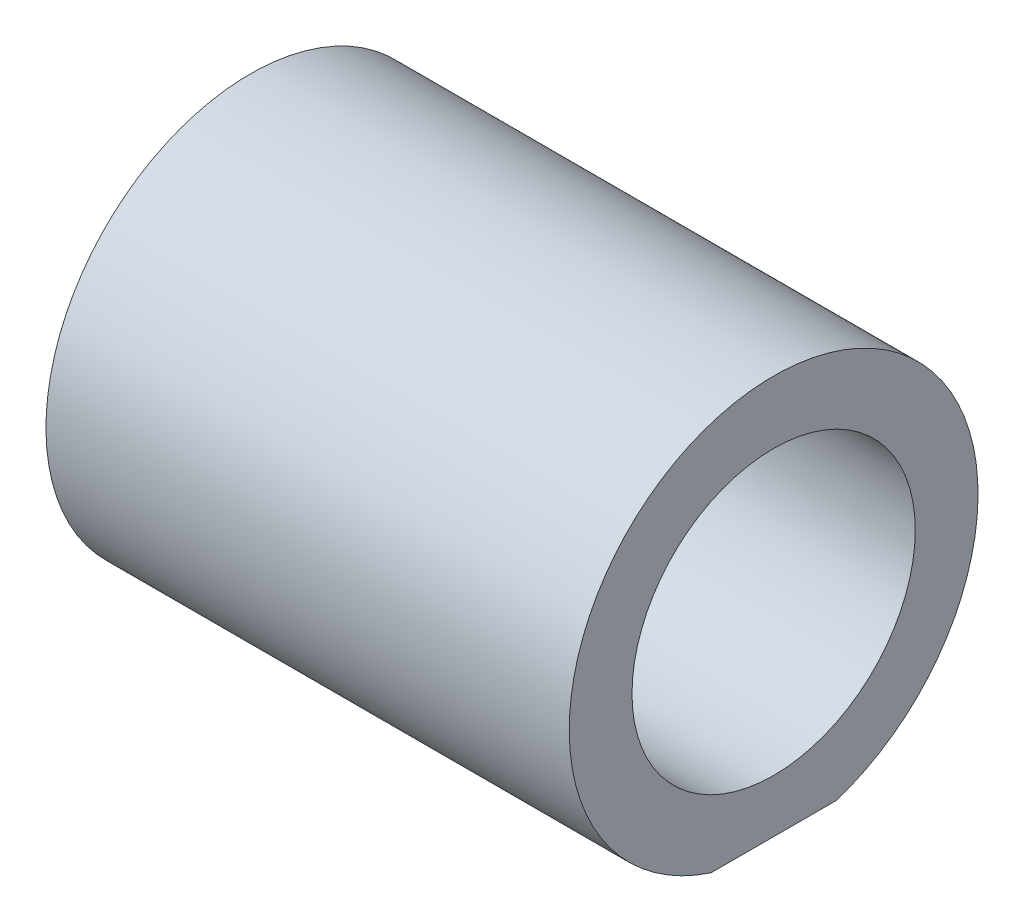
from build123d import *

# Parameters (mm, degrees)
SKETCH1_R           = 5.500000049
BOSS_EXTRUDE1_DEPTH = 20.32


with BuildPart() as part:
    # Sketch1 → Boss-Extrude1 (new body)
    with BuildSketch(Plane.YZ):
        with BuildLine():
            Line((-7.5565, -2.429653062), (-7.5565, 2.429653062))
            ThreePointArc((-7.5565, 2.429653062), (7.9375, 0), (-7.5565, -2.429653062))
        make_face()
        Circle(SKETCH1_R, mode=Mode.SUBTRACT)
    extrude(amount=BOSS_EXTRUDE1_DEPTH)


solid = part.part
